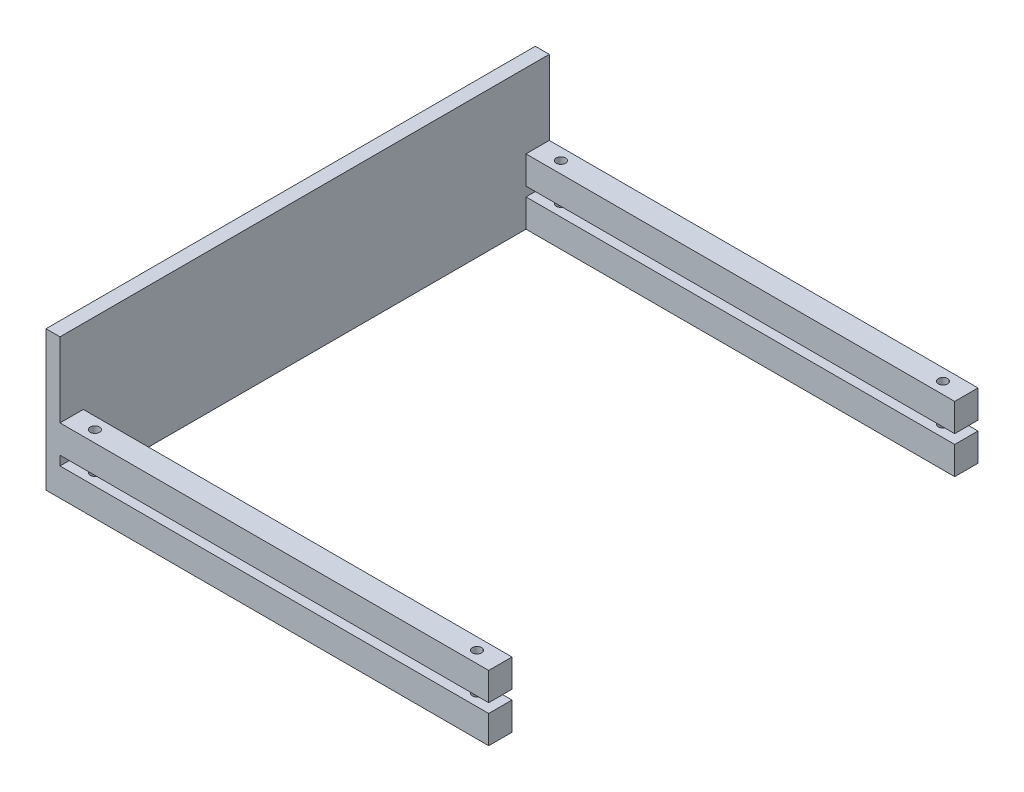
from build123d import *

# Parameters (mm, degrees)
BOSS_EXTRUDE1_DEPTH = 105
CUT_EXTRUDE1_DEPTH  = 141.516902898
SKETCH3_R           = 1
CUT_EXTRUDE2_DEPTH  = 141.516902898


with BuildPart() as part:
    # Sketch1 → Boss-Extrude1 (new body)
    with BuildSketch(Plane.XY):
        Polygon((0, 16), (0, 0), (92, 0), (92, -14), (-3, -14), (-3, 16), align=None)
    extrude(amount=-BOSS_EXTRUDE1_DEPTH)

    # Sketch2 → Cut-Extrude1 (cut, through all)
    with BuildSketch(Plane(origin=(0, 0, 0), x_dir=(0, 0, -1), z_dir=(1, 0, 0))):
        Polygon((0, -6), (5, -6), (5, 0), (100, 0), (100, -6), (105, -6), (105, -8), (100, -8), (100, -14), (5, -14), (5, -8), (0, -8), align=None)
    extrude(amount=CUT_EXTRUDE1_DEPTH, mode=Mode.SUBTRACT)

    # Sketch3 → Cut-Extrude2 (cut, through all)
    with BuildSketch(Plane(origin=(0, 0, 0), x_dir=(1, 0, 0), z_dir=(0, 1, 0))):
        with Locations((87, 102.5)):
            Circle(SKETCH3_R)
        with Locations((5, 102.5)):
            Circle(SKETCH3_R)
        with Locations((5, 2.5)):
            Circle(SKETCH3_R)
        with Locations((87, 2.5)):
            Circle(SKETCH3_R)
    extrude(amount=-CUT_EXTRUDE2_DEPTH, mode=Mode.SUBTRACT)


solid = part.part
